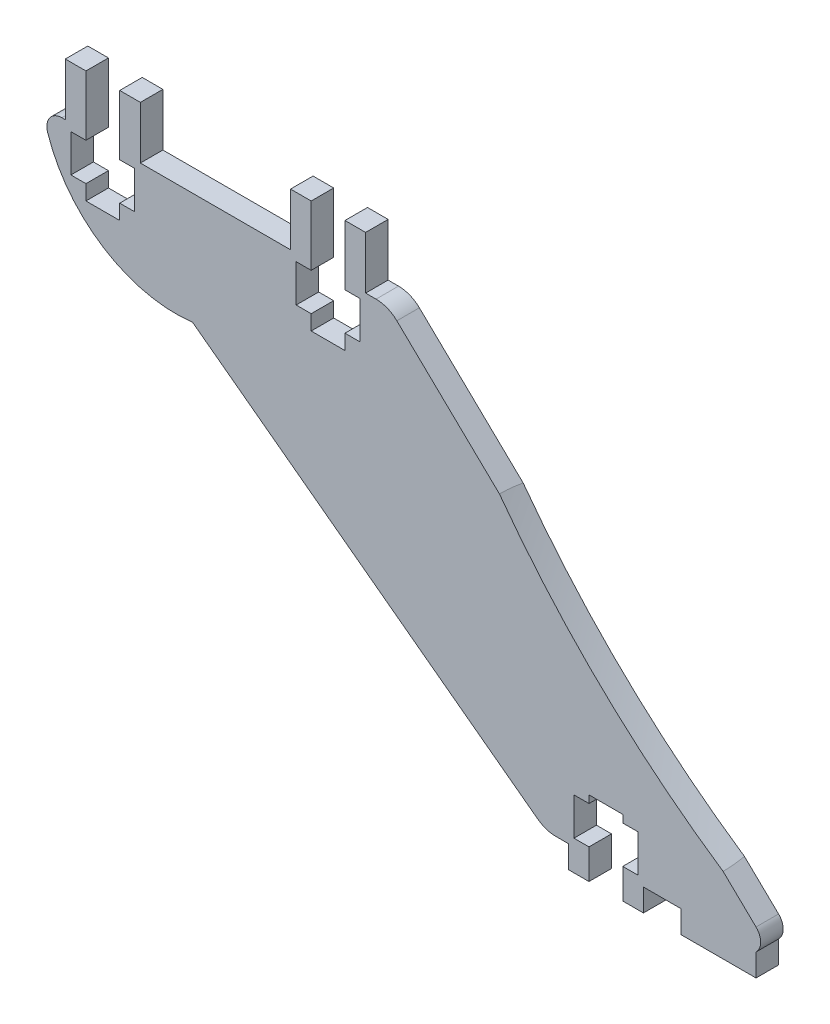
from build123d import *

# Parameters (mm, degrees)
SKETCH_1_W          = 10
SKETCH_1_H          = 3
SKETCH_1_H_2        = 7
EXTRUDE_1_DEPTH     = 1.5
FILLET_1_R          = 4
EXTRUDE_2_DEPTH     = 3
CUT_EXTRUDE_1_DEPTH = 112.454026397
FILLET_2_R          = 2


with BuildPart() as part:
    # 草图1 → 凸台-拉伸1 (new, symmetric)
    with BuildSketch(Plane.XY):
        with Locations((90, -51.5)):
            Rectangle(SKETCH_1_W, SKETCH_1_H)
        Polygon((67, -50), (0, 0), (46, 0), (98, -50), align=None)
        with Locations((38, 3.5)):
            Rectangle(SKETCH_1_W, SKETCH_1_H_2)
        with Locations((8, 3.5)):
            Rectangle(SKETCH_1_W, SKETCH_1_H_2)
        with Locations((75, -51.5)):
            Rectangle(SKETCH_1_W, SKETCH_1_H)
    extrude(amount=EXTRUDE_1_DEPTH, both=True)

    # 圆角1
    fillet_1_edges = [part.edges().sort_by_distance(p)[0] for p in [
        (67, -50, 0),
        (46, 0, 0),
    ]]
    fillet(fillet_1_edges, radius=FILLET_1_R)

    # 草图5 → 凸台-拉伸2 (add)
    with BuildSketch(Plane.XY.offset(1.5)):
        with BuildLine():
            ThreePointArc((0, 0), (6.98733973, -11.453256458), (19.95552359, -14.892181783))
            Line((19.95552359, -14.892181783), (0, 0))
        make_face()
    extrude(amount=-EXTRUDE_2_DEPTH)

    # 草图2 → 切除-拉伸1 (cut, through all)
    with BuildSketch(Plane.XY.offset(1.5)):
        Polygon((72.75, -53), (72.75, -49), (70.75, -49), (70.75, -44), (72.75, -44), (72.75, -43), (77.25, -43), (77.25, -44), (79.25, -44), (79.25, -49), (77.25, -49), (77.25, -53), align=None)
        Polygon((35.75, 7), (35.75, -1), (33.75, -1), (33.75, -6), (35.75, -6), (35.75, -8), (40.25, -8), (40.25, -6), (42.25, -6), (42.25, -1), (40.25, -1), (40.25, 7), align=None)
        Polygon((10.25, 7), (5.75, 7), (5.75, -1), (3.75, -1), (3.75, -6), (5.75, -6), (5.75, -8), (10.25, -8), (10.25, -6), (12.25, -6), (12.25, -1), (10.25, -1), align=None)
    extrude(amount=-CUT_EXTRUDE_1_DEPTH, mode=Mode.SUBTRACT)

    # 草图3 → 切除-旋转3 (revolve, cut)
    with BuildSketch(Plane.XY.offset(1.5)):
        with BuildLine():
            Line((158, -63.5), (158, 177.5))
            ThreePointArc((158, 177.5), (37.5, 57), (158, -63.5))
        make_face()
    revolve(axis=Axis((158, -1021.279080972, 1.5), (0, 1, 0)), mode=Mode.SUBTRACT)

    # 圆角2
    # the kernel refuses this fillet: 2 mm, written as the material it takes off along each edge
    with BuildSketch(Plane(origin=(98, -50, -11.90231354), x_dir=(-1, 0, 0), z_dir=(0, 0, 1))) as fillet_2_piece_1:
        with BuildLine():
            CenterArc((4.385550053, -1.442307544), FILLET_2_R, 133.850179686, 92.273123028)
            Line((2.99933262, -2.883973674), (2.971608272, -2.912806996))
            Line((2.971608272, -2.912806996), (-0.027724349, -0.028833323))
            Line((-0.027724349, -0.028833323), (0, 0.04))
            ThreePointArc((0, 0.04), (1.5, 0.04), (2.972288999, 0.028846151))
            Line((2.972288999, 0.028846151), (3, 0))
        make_face()
    extrude(amount=23.80462708, mode=Mode.SUBTRACT)
    with BuildSketch(Plane(origin=(0, 0, 8.248897597), x_dir=(0.23863429141871206, -0.971109507192206, 0), z_dir=(0, 0, -1))) as fillet_2_piece_2:
        with BuildLine():
            CenterArc((2.549583536, -1.99436891), FILLET_2_R, 85.699481489, 108.106467665)
            Line((0.607364522, -2.471637493), (0.568520142, -2.481182864))
            Line((0.568520142, -2.481182864), (-0.03884438, -0.009545372))
            Line((-0.03884438, -0.009545372), (-0.00299951, 0.039887378))
            ThreePointArc((-0.00299951, 0.039887378), (1.349779519, 0.090679811), (2.702558549, 0.039887378))
            Line((2.702558549, 0.039887378), (2.699559039, 0))
        make_face()
    extrude(amount=16.497795193, mode=Mode.SUBTRACT)


solid = part.part
